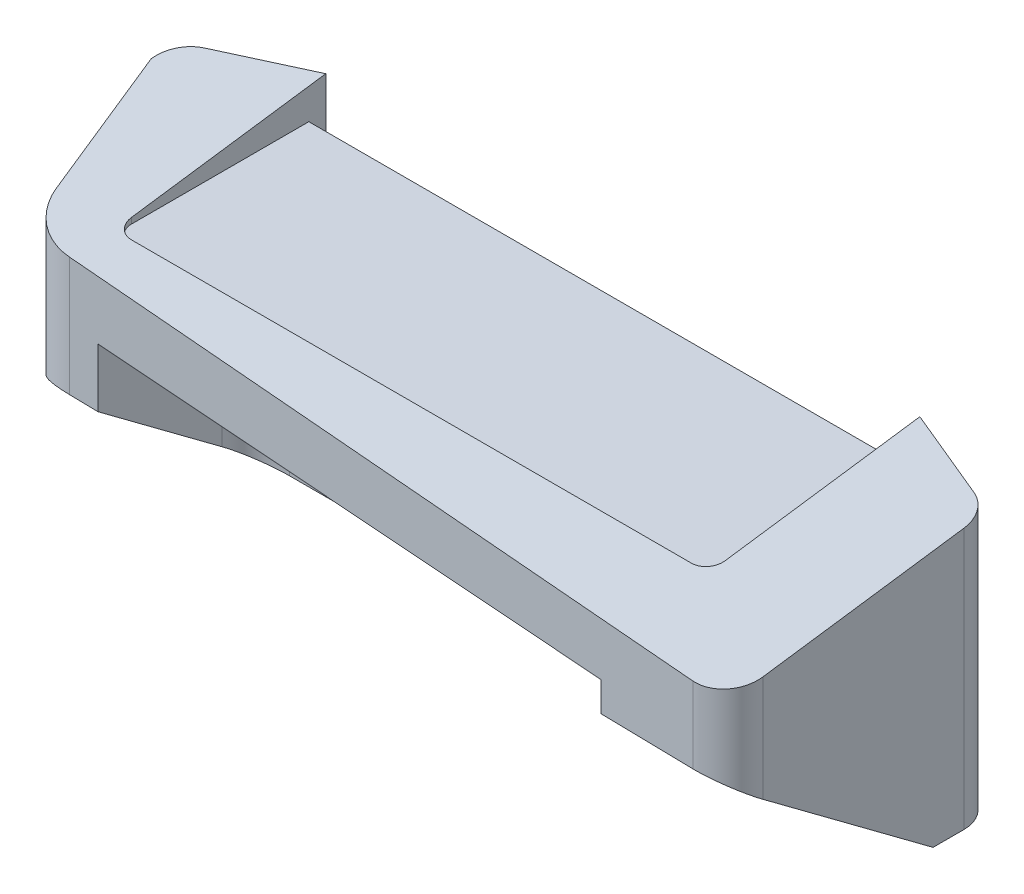
from build123d import *

# Parameters (mm, degrees)
SKETCH1_W                 = 120
SKETCH1_H                 = 40
BILLET_DEPTH              = 50
CUT_EXTRUDE3_DEPTH        = 132.52946438
BOTTOM_BEVEL_DEPTH        = 88.749643874
HEEL_AND_TOE_RELIEF_DEPTH = 88.749643874
HEEL_AND_TOE_FILLET_R     = 5
SKETCH13_W                = 80
SKETCH13_H                = 25.995958265
BODY_CAVITY_DEPTH         = 35
BODY_CAVITY_FILLETS_R     = 5
SKETCH14_W                = 120
SKETCH14_H                = 50
BACK_ANGLE_ANGLE          = 36.675
HEEL_RELIEF_DEPTH         = 88.749643874
CUT_EXTRUDE4_DEPTH        = 88.749643874
FILLET1_R                 = 10
FILLET2_R                 = 5
SKETCH17_W                = 87.701997658
SKETCH17_H                = 32
FACE_INSERT_DEPTH         = 5
FILLET3_R                 = 2.5
CUT_EXTRUDE6_DEPTH        = 83.832881242
M5X0_8_TAPPED_HOLE1_D     = 4.2
M5X0_8_TAPPED_HOLE2_D     = 4.2
M5X0_8_TAPPED_HOLE2_DEPTH = 8
M5X0_8_TAPPED_HOLE2_TIP   = 1.2618073


with BuildPart() as part:
    # Sketch1 → Billet (new body)
    with BuildSketch(Plane.XY):
        Rectangle(SKETCH1_W, SKETCH1_H)
    extrude(amount=BILLET_DEPTH)

    # Sketch9 → Cut-Extrude3 (cut, through all)
    with BuildSketch(Plane.ZY.offset(60)):
        Polygon((0, 20), (52.520581483, 20), (52.520581483, 12.618713639), align=None)
    extrude(amount=-CUT_EXTRUDE3_DEPTH, mode=Mode.SUBTRACT)

    # Sketch10 → Bottom Bevel (cut, through all)
    with BuildSketch(Plane(origin=(0, 20, 0), x_dir=(1, 0, 0), z_dir=(0, 1, 0))):
        with BuildLine():
            Line((0, 0), (-60, 0))
            Line((-60, 0), (-60, -1.5))
            ThreePointArc((-60, -1.5), (-30.009373536, -0.375058575), (0, 0))
        make_face()
        with BuildLine():
            Line((60, 0), (0, 0))
            ThreePointArc((0, 0), (30.009373536, -0.375058575), (60, -1.5))
            Line((60, -1.5), (60, 0))
        make_face()
    extrude(amount=-BOTTOM_BEVEL_DEPTH, mode=Mode.SUBTRACT)

    # Sketch11 → Heel and Toe Relief (cut, through all)
    with BuildSketch(Plane(origin=(0, 20, 0), x_dir=(1, 0, 0), z_dir=(0, 1, 0))):
        Polygon((-60, 0), (-60, -7), (-41.764376547, 0), align=None)
        Polygon((60, -7), (41.764376547, 0), (60, 0), align=None)
    extrude(amount=-HEEL_AND_TOE_RELIEF_DEPTH, mode=Mode.SUBTRACT)

    # Heel and Toe Fillet
    heel_and_toe_fillet_edges = [part.edges().sort_by_distance(p)[0] for p in [
        (-60, -0.491892921, 7),
        (60, -0.491892921, 7),
    ]]
    fillet(heel_and_toe_fillet_edges, radius=HEEL_AND_TOE_FILLET_R)

    # Sketch13 → Body Cavity (cut)
    with BuildSketch(Plane.XY.offset(50)):
        with Locations((0, -7.002020867)):
            Rectangle(SKETCH13_W, SKETCH13_H)
    extrude(amount=-BODY_CAVITY_DEPTH, mode=Mode.SUBTRACT)

    # Body Cavity Fillets
    body_cavity_fillets_edges = [part.edges().sort_by_distance(p)[0] for p in [
        (40, -7.002020868, 15),
        (-40, -7.002020868, 15),
    ]]
    fillet(body_cavity_fillets_edges, radius=BODY_CAVITY_FILLETS_R)

    # Sketch14 → Back Angle (revolve, cut)
    with BuildSketch(Plane(origin=(0, -20, 0), x_dir=(-1, 0, 0), z_dir=(0, -1, 0))):
        with Locations((0, -40)):
            Rectangle(SKETCH14_W, SKETCH14_H)
    revolve(axis=Axis((-60, -20, 15), (-1, 0, 0)), revolution_arc=BACK_ANGLE_ANGLE, mode=Mode.SUBTRACT)

    # Sketch15 → Heel Relief (cut, through all)
    with BuildSketch(Plane(origin=(0, 20, 0), x_dir=(1, 0, 0), z_dir=(0, 1, 0))):
        Polygon((-60, -10.436404793), (-47.25, -50), (-60, -50), align=None)
    extrude(amount=-HEEL_RELIEF_DEPTH, mode=Mode.SUBTRACT)

    # Sketch16 → Cut-Extrude4 (cut, through all)
    with BuildSketch(Plane(origin=(0, 20, 0), x_dir=(1, 0, 0), z_dir=(0, 1, 0))):
        Polygon((60, -45.5), (-51.294823579, -37.448802921), (-47.25, -50), (60, -50), align=None)
    extrude(amount=-CUT_EXTRUDE4_DEPTH, mode=Mode.SUBTRACT)

    # Fillet1
    fillet1_edges = [part.edges().sort_by_distance(p)[0] for p in [
        (-51.294823579, 5.727251876, 37.448802921),
    ]]
    fillet(fillet1_edges, radius=FILLET1_R)

    # Fillet2
    fillet2_edges = [part.edges().sort_by_distance(p)[0] for p in [
        (60, 8.159348074, 45.5),
    ]]
    fillet(fillet2_edges, radius=FILLET2_R)

    # Sketch17 → Face Insert (cut)
    with BuildSketch(Plane(origin=(0, 20, 0), x_dir=(1, 0, 0), z_dir=(0, 1, 0))):
        with Locations((0, -16)):
            Rectangle(SKETCH17_W, SKETCH17_H)
    extrude(amount=-FACE_INSERT_DEPTH, mode=Mode.SUBTRACT)

    # Fillet3
    fillet3_edges = [part.edges().sort_by_distance(p)[0] for p in [
        (-43.850998829, 15.251346645, 32),
        (43.850998829, 15.251346645, 32),
    ]]
    fillet(fillet3_edges, radius=FILLET3_R)

    # Sketch18 → Cut-Extrude6 (cut, through all)
    with BuildSketch(Plane(origin=(0, 15, 0), x_dir=(1, 0, 0), z_dir=(0, 1, 0))):
        with BuildLine():
            Line((-43.850998829, -0.800979249), (-43.850998829, -3.300979249))
            Line((-43.850998829, -3.300979249), (43.850998829, -3.300979249))
            Line((43.850998829, -3.300979249), (43.850998829, -0.800979249))
            ThreePointArc((43.850998829, -0.800979249), (0, 0), (-43.850998829, -0.800979249))
        make_face()
    extrude(amount=-CUT_EXTRUDE6_DEPTH, mode=Mode.SUBTRACT)

    # M5x0.8 Tapped Hole1 (through all)
    with Locations(Plane.XY.offset(15)):
        with Locations((5, -8.504041735), (-25, -8.504041735)):
            Hole(M5X0_8_TAPPED_HOLE1_D / 2)

    # M5x0.8 Tapped Hole2
    with Locations(Plane(origin=(0, 0, 3.300979249), x_dir=(-1, 0, 0), z_dir=(0, 0, -1))):
        with Locations((-33.8, 0.1), (33.8, 0.1)):
            Hole(M5X0_8_TAPPED_HOLE2_D / 2, depth=M5X0_8_TAPPED_HOLE2_DEPTH)
            with Locations((0, 0, -(M5X0_8_TAPPED_HOLE2_DEPTH + M5X0_8_TAPPED_HOLE2_TIP / 2))):  # 118° drill point
                Cone(0, M5X0_8_TAPPED_HOLE2_D / 2, M5X0_8_TAPPED_HOLE2_TIP, mode=Mode.SUBTRACT)


solid = part.part
